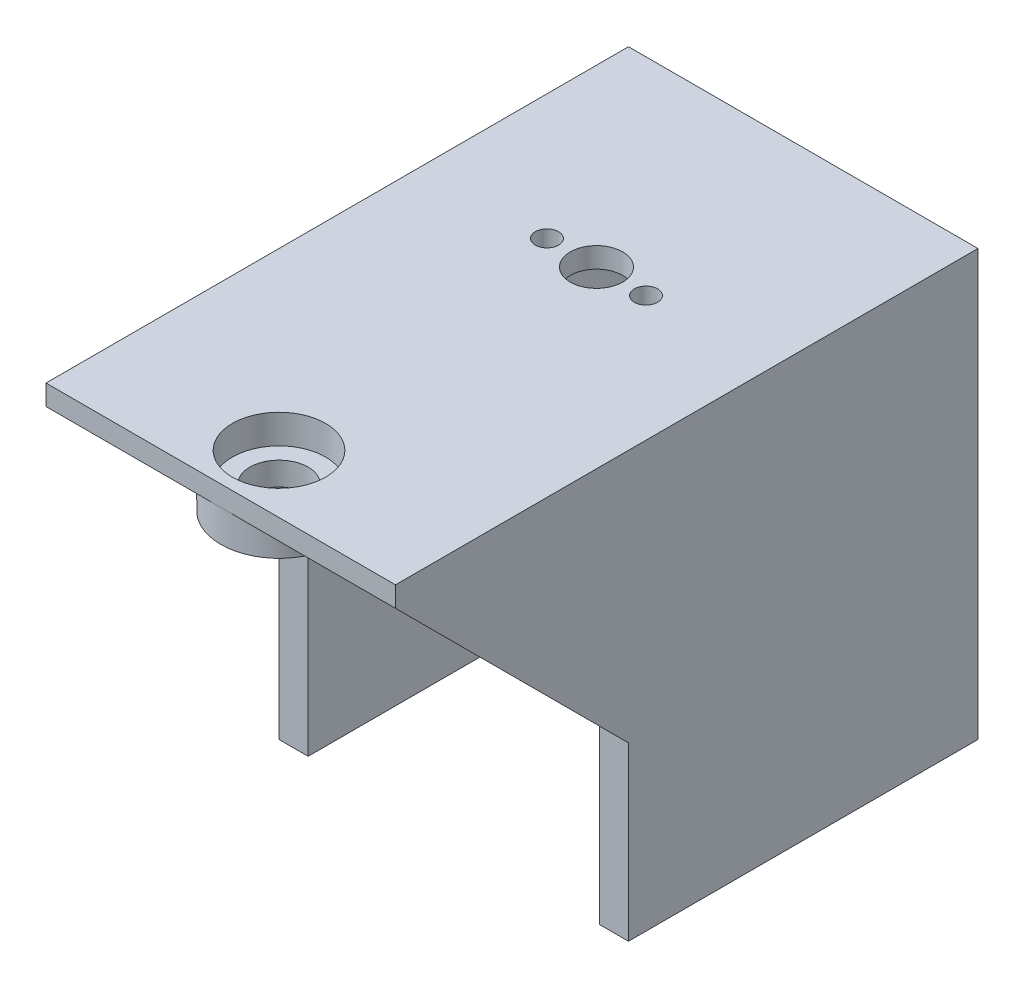
from build123d import *

# Parameters (mm, degrees)
CROQUIS1_W                       = 60
CROQUIS1_H                       = 60
SALIENTE_EXTRUIR1_DEPTH          = 73
CORTAR_EXTRUIR1_REACH            = 101.141
CROQUIS2_W                       = 50
CROQUIS2_H                       = 69.5
CORTAR_EXTRUIR2_REACH            = 86.433
CROQUIS3_R                       = 2
CHAFL_N1_SIZE                    = 5
TALADRO_DE_MARGEN_PARA_M31_D     = 3.4
TALADRO_DE_MARGEN_PARA_M31_DEPTH = 40
TALADRO_DE_MARGEN_PARA_M31_TIP   = 1.021463052
TALADRO_DE_MARGEN_PARA_M32_D     = 3.4
TALADRO_DE_MARGEN_PARA_M32_DEPTH = 40
TALADRO_DE_MARGEN_PARA_M32_TIP   = 1.021463052
TALADRO_DE_MARGEN_PARA_M33_D     = 3.4
TALADRO_DE_MARGEN_PARA_M33_DEPTH = 40
TALADRO_DE_MARGEN_PARA_M33_TIP   = 1.021463052
CROQUIS11_W                      = 60
CROQUIS11_H                      = 3.5
SALIENTE_EXTRUIR2_DEPTH          = 40
CHAFL_N2_SIZE                    = 40
CORTAR_EXTRUIR3_REACH            = 107.494
CROQUIS12_R                      = 2.5
CROQUIS14_R                      = 10
SALIENTE_EXTRUIR3_DEPTH          = 7
CROQUIS15_R                      = 10
SALIENTE_EXTRUIR4_DEPTH          = 2
CROQUIS13_R                      = 8
CORTAR_EXTRUIR5_DEPTH            = 5
CROQUIS16_R                      = 5
CORTAR_EXTRUIR6_DEPTH            = 5
CROQUIS17_R                      = 4.5
CORTAR_EXTRUIR7_DEPTH            = 16


with BuildPart() as part:
    # Croquis1 → Saliente-Extruir1 (new body)
    with BuildSketch(Plane(origin=(0, 0, 0), x_dir=(1, 0, 0), z_dir=(0, 1, 0))):
        Rectangle(CROQUIS1_W, CROQUIS1_H)
    extrude(amount=SALIENTE_EXTRUIR1_DEPTH)

    # Croquis2 → Cortar-Extruir1 (cut, up to next)
    with BuildSketch(Plane.XY.offset(30), mode=Mode.PRIVATE) as cortar_extruir1_sk1:
        with Locations((0, 34.75)):
            Rectangle(CROQUIS2_W, CROQUIS2_H)
    cortar_extruir1_tool1 = extrude(cortar_extruir1_sk1.sketch, amount=-CORTAR_EXTRUIR1_REACH, mode=Mode.PRIVATE) & part.part
    add(cortar_extruir1_tool1.solids().sort_by_distance((0, 34.75, 30))[0], mode=Mode.SUBTRACT)

    # Croquis3 → Cortar-Extruir2 (cut, up to next)
    with BuildSketch(Plane(origin=(0, 73, 0), x_dir=(1, 0, 0), z_dir=(0, 1, 0)), mode=Mode.PRIVATE) as cortar_extruir2_sk1:
        with Locations(Location((-8.5, -5.5, 0), (0, 0, 270))):
            Circle(CROQUIS3_R)
    cortar_extruir2_tool1 = extrude(cortar_extruir2_sk1.sketch, amount=-CORTAR_EXTRUIR2_REACH, mode=Mode.PRIVATE) & part.part
    # Croquis3 → Cortar-Extruir2 (cut, up to next)
    with BuildSketch(Plane(origin=(0, 73, 0), x_dir=(1, 0, 0), z_dir=(0, 1, 0)), mode=Mode.PRIVATE) as cortar_extruir2_sk2:
        with Locations(Location((8.5, -5.5, 0), (0, 0, 270))):
            Circle(CROQUIS3_R)
    cortar_extruir2_tool2 = extrude(cortar_extruir2_sk2.sketch, amount=-CORTAR_EXTRUIR2_REACH, mode=Mode.PRIVATE) & part.part
    add(cortar_extruir2_tool1.solids().sort_by_distance((-8.5, 73, 5.5))[0], mode=Mode.SUBTRACT)
    add(cortar_extruir2_tool2.solids().sort_by_distance((8.5, 73, 5.5))[0], mode=Mode.SUBTRACT)

    # Chaflán1
    chafl_n1_edges = [part.edges().sort_by_distance(p)[0] for p in [
        (-25, 69.5, 0),
        (25, 69.5, 0),
    ]]
    chamfer(chafl_n1_edges, length=CHAFL_N1_SIZE)

    # Taladro de margen para M31
    with Locations(Plane.XZ):
        with Locations((27.5, -20), (27.5, 20)):
            Hole(TALADRO_DE_MARGEN_PARA_M31_D / 2, depth=TALADRO_DE_MARGEN_PARA_M31_DEPTH)
            with Locations((0, 0, -(TALADRO_DE_MARGEN_PARA_M31_DEPTH + TALADRO_DE_MARGEN_PARA_M31_TIP / 2))):  # 118° drill point
                Cone(0, TALADRO_DE_MARGEN_PARA_M31_D / 2, TALADRO_DE_MARGEN_PARA_M31_TIP, mode=Mode.SUBTRACT)

    # Taladro de margen para M32
    with Locations(Plane.XZ):
        with Locations((-27.5, 20), (-27.5, -20)):
            Hole(TALADRO_DE_MARGEN_PARA_M32_D / 2, depth=TALADRO_DE_MARGEN_PARA_M32_DEPTH)
            with Locations((0, 0, -(TALADRO_DE_MARGEN_PARA_M32_DEPTH + TALADRO_DE_MARGEN_PARA_M32_TIP / 2))):  # 118° drill point
                Cone(0, TALADRO_DE_MARGEN_PARA_M32_D / 2, TALADRO_DE_MARGEN_PARA_M32_TIP, mode=Mode.SUBTRACT)

    # Taladro de margen para M33
    with Locations(Plane.XZ):
        with Locations((-27.5, 0), (27.5, 1.783505525)):
            Hole(TALADRO_DE_MARGEN_PARA_M33_D / 2, depth=TALADRO_DE_MARGEN_PARA_M33_DEPTH)
            with Locations((0, 0, -(TALADRO_DE_MARGEN_PARA_M33_DEPTH + TALADRO_DE_MARGEN_PARA_M33_TIP / 2))):  # 118° drill point
                Cone(0, TALADRO_DE_MARGEN_PARA_M33_D / 2, TALADRO_DE_MARGEN_PARA_M33_TIP, mode=Mode.SUBTRACT)

    # Croquis11 → Saliente-Extruir2 (add)
    with BuildSketch(Plane.XY.offset(30)):
        with Locations((0, 71.25)):
            Rectangle(CROQUIS11_W, CROQUIS11_H)
    extrude(amount=SALIENTE_EXTRUIR2_DEPTH)

    # Chaflán2
    # the kernel refuses this chamfer: 40 mm, written as the material it adds along each edge
    with BuildSketch(Plane(origin=(30, 69.5, 30), x_dir=(0, -0.9996219169112968, -0.027495876610586403), z_dir=(-1, 0, 0))) as chafl_n2_piece_1_section:
        Polygon((CHAFL_N2_SIZE * 0.999621916911, CHAFL_N2_SIZE * 0.0274958766106), (-CHAFL_N2_SIZE * 0.0274958766106, CHAFL_N2_SIZE * 0.999621916911), (0, 0), align=None)
    chafl_n2_piece_1 = extrude(amount=112.867319519, mode=Mode.PRIVATE)
    chafl_n2_piece_1 = split(chafl_n2_piece_1, bisect_by=Plane(origin=(25, 65.769230769, 48.134615385), z_dir=(1, 0, 0)), keep=Keep.TOP, mode=Mode.PRIVATE)
    add(chafl_n2_piece_1)
    with BuildSketch(Plane(origin=(132.867319519, 69.5, 30), x_dir=(0, -0.9996219169112968, -0.027495876610586403), z_dir=(-1, 0, 0))) as chafl_n2_piece_2_section:
        Polygon((CHAFL_N2_SIZE * 0.999621916911, CHAFL_N2_SIZE * 0.0274958766106), (-CHAFL_N2_SIZE * 0.0274958766106, CHAFL_N2_SIZE * 0.999621916911), (0, 0), align=None)
    chafl_n2_piece_2 = extrude(amount=215.734639037, mode=Mode.PRIVATE)
    chafl_n2_piece_2 = split(chafl_n2_piece_2, bisect_by=Plane(origin=(22.472826087, 67.027173913, 49.184782609), z_dir=(0.7071067811865476, 0.7071067811865476, 0)), keep=Keep.TOP, mode=Mode.PRIVATE)
    chafl_n2_piece_2 = split(chafl_n2_piece_2, bisect_by=Plane(origin=(25, 67.869565217, 49.184782609), z_dir=(-1, 0, 0)), keep=Keep.TOP, mode=Mode.PRIVATE)
    add(chafl_n2_piece_2)
    with BuildSketch(Plane(origin=(132.867319519, 69.5, 30), x_dir=(0, -0.9996219169112968, -0.027495876610586403), z_dir=(-1, 0, 0))) as chafl_n2_piece_3_section:
        Polygon((CHAFL_N2_SIZE * 0.999621916911, CHAFL_N2_SIZE * 0.0274958766106), (-CHAFL_N2_SIZE * 0.0274958766106, CHAFL_N2_SIZE * 0.999621916911), (0, 0), align=None)
    chafl_n2_piece_3 = extrude(amount=215.734639037, mode=Mode.PRIVATE)
    chafl_n2_piece_3 = split(chafl_n2_piece_3, bisect_by=Plane(origin=(-30, 67.869565217, 49.184782609), z_dir=(1, 0, 0)), keep=Keep.TOP, mode=Mode.PRIVATE)
    chafl_n2_piece_3 = split(chafl_n2_piece_3, bisect_by=Plane(origin=(-22.472826087, 67.027173913, 49.184782609), z_dir=(-0.7071067811865476, 0.7071067811865476, 0)), keep=Keep.TOP, mode=Mode.PRIVATE)
    add(chafl_n2_piece_3)
    with BuildSketch(Plane(origin=(132.867319519, 69.5, 30), x_dir=(0, -0.9996219169112968, -0.027495876610586403), z_dir=(-1, 0, 0))) as chafl_n2_piece_4_section:
        Polygon((CHAFL_N2_SIZE * 0.999621916911, CHAFL_N2_SIZE * 0.0274958766106), (-CHAFL_N2_SIZE * 0.0274958766106, CHAFL_N2_SIZE * 0.999621916911), (0, 0), align=None)
    chafl_n2_piece_4 = extrude(amount=215.734639037, mode=Mode.PRIVATE)
    chafl_n2_piece_4 = split(chafl_n2_piece_4, bisect_by=Plane(origin=(-25, 51.251968504, 40.875984252), z_dir=(-1, 0, 0)), keep=Keep.TOP, mode=Mode.PRIVATE)
    chafl_n2_piece_4 = split(chafl_n2_piece_4, bisect_by=Plane(origin=(-30, 51.251968504, 40.875984252), z_dir=(1, 0, 0)), keep=Keep.TOP, mode=Mode.PRIVATE)
    add(chafl_n2_piece_4)
    with BuildSketch(Plane(origin=(82.867319519, 69.5, 30), x_dir=(0, -0.9996219169112968, -0.027495876610586403), z_dir=(-1, 0, 0))) as chafl_n2_piece_5_section:
        Polygon((CHAFL_N2_SIZE * 0.999621916911, CHAFL_N2_SIZE * 0.0274958766106), (-CHAFL_N2_SIZE * 0.0274958766106, CHAFL_N2_SIZE * 0.999621916911), (0, 0), align=None)
    chafl_n2_piece_5 = extrude(amount=215.734639037, mode=Mode.PRIVATE)
    chafl_n2_piece_5 = split(chafl_n2_piece_5, bisect_by=Plane(origin=(30, 65.769230769, 48.134615385), z_dir=(-1, 0, 0)), keep=Keep.TOP, mode=Mode.PRIVATE)
    chafl_n2_piece_5 = split(chafl_n2_piece_5, bisect_by=Plane(origin=(25, 65.769230769, 48.134615385), z_dir=(1, 0, 0)), keep=Keep.TOP, mode=Mode.PRIVATE)
    add(chafl_n2_piece_5)
    with BuildSketch(Plane(origin=(82.867319519, 69.5, 30), x_dir=(0, -0.9996219169112968, -0.027495876610586403), z_dir=(-1, 0, 0))) as chafl_n2_piece_6_section:
        Polygon((CHAFL_N2_SIZE * 0.999621916911, CHAFL_N2_SIZE * 0.0274958766106), (-CHAFL_N2_SIZE * 0.0274958766106, CHAFL_N2_SIZE * 0.999621916911), (0, 0), align=None)
    chafl_n2_piece_6 = extrude(amount=215.734639037, mode=Mode.PRIVATE)
    chafl_n2_piece_6 = split(chafl_n2_piece_6, bisect_by=Plane(origin=(22.472826087, 67.027173913, 49.184782609), z_dir=(0.7071067811865476, 0.7071067811865476, 0)), keep=Keep.TOP, mode=Mode.PRIVATE)
    chafl_n2_piece_6 = split(chafl_n2_piece_6, bisect_by=Plane(origin=(25, 67.869565217, 49.184782609), z_dir=(-1, 0, 0)), keep=Keep.TOP, mode=Mode.PRIVATE)
    add(chafl_n2_piece_6)
    with BuildSketch(Plane(origin=(82.867319519, 69.5, 30), x_dir=(0, -0.9996219169112968, -0.027495876610586403), z_dir=(-1, 0, 0))) as chafl_n2_piece_7_section:
        Polygon((CHAFL_N2_SIZE * 0.999621916911, CHAFL_N2_SIZE * 0.0274958766106), (-CHAFL_N2_SIZE * 0.0274958766106, CHAFL_N2_SIZE * 0.999621916911), (0, 0), align=None)
    chafl_n2_piece_7 = extrude(amount=112.867319519, mode=Mode.PRIVATE)
    chafl_n2_piece_7 = split(chafl_n2_piece_7, bisect_by=Plane(origin=(-22.472826087, 67.027173913, 49.184782609), z_dir=(-0.7071067811865476, 0.7071067811865476, 0)), keep=Keep.TOP, mode=Mode.PRIVATE)
    add(chafl_n2_piece_7)
    with BuildSketch(Plane(origin=(82.867319519, 69.5, 30), x_dir=(0, -0.9996219169112968, -0.027495876610586403), z_dir=(-1, 0, 0))) as chafl_n2_piece_8_section:
        Polygon((CHAFL_N2_SIZE * 0.999621916911, CHAFL_N2_SIZE * 0.0274958766106), (-CHAFL_N2_SIZE * 0.0274958766106, CHAFL_N2_SIZE * 0.999621916911), (0, 0), align=None)
    chafl_n2_piece_8 = extrude(amount=112.867319519, mode=Mode.PRIVATE)
    chafl_n2_piece_8 = split(chafl_n2_piece_8, bisect_by=Plane(origin=(-25, 51.251968504, 40.875984252), z_dir=(-1, 0, 0)), keep=Keep.TOP, mode=Mode.PRIVATE)
    add(chafl_n2_piece_8)

    # Croquis12 → Cortar-Extruir3 (cut, up to next)
    with BuildSketch(Plane(origin=(0, 73, 0), x_dir=(1, 0, 0), z_dir=(0, 1, 0)), mode=Mode.PRIVATE) as cortar_extruir3_sk1:
        with Locations(Location((0, -60, 0), (0, 0, 270))):
            Circle(CROQUIS12_R)
    cortar_extruir3_tool1 = extrude(cortar_extruir3_sk1.sketch, amount=-CORTAR_EXTRUIR3_REACH, mode=Mode.PRIVATE) & part.part
    add(cortar_extruir3_tool1.solids().sort_by_distance((0, 73, 60))[0], mode=Mode.SUBTRACT)

    # Croquis14 → Saliente-Extruir3 (add)
    with BuildSketch(Plane(origin=(0, 73, 0), x_dir=(1, 0, 0), z_dir=(0, 1, 0))):
        with Locations(Location((0, -60, 0), (0, 0, 270))):
            Circle(CROQUIS14_R)
    extrude(amount=-SALIENTE_EXTRUIR3_DEPTH)

    # Croquis15 → Saliente-Extruir4 (add)
    with BuildSketch(Plane.XZ.offset(-66)):
        with Locations(Location((0, 60, 0), (0, 0, 90))):
            Circle(CROQUIS15_R)
    extrude(amount=SALIENTE_EXTRUIR4_DEPTH)

    # Croquis13 → Cortar-Extruir5 (cut)
    with BuildSketch(Plane(origin=(0, 73, 0), x_dir=(1, 0, 0), z_dir=(0, 1, 0))):
        with Locations(Location((0, -60, 0), (0, 0, 270))):
            Circle(CROQUIS13_R)
    extrude(amount=-CORTAR_EXTRUIR5_DEPTH, mode=Mode.SUBTRACT)

    # Croquis16 → Cortar-Extruir6 (cut)
    with BuildSketch(Plane(origin=(0, 68, 0), x_dir=(1, 0, 0), z_dir=(0, 1, 0))):
        with Locations(Location((0, -60, 0), (0, 0, 270))):
            Circle(CROQUIS16_R)
    extrude(amount=-CORTAR_EXTRUIR6_DEPTH, mode=Mode.SUBTRACT)

    # Croquis17 → Cortar-Extruir7 (cut)
    with BuildSketch(Plane(origin=(0, 73, 0), x_dir=(1, 0, 0), z_dir=(0, 1, 0))):
        with Locations(Location((0, -5.5, 0), (0, 0, 270))):
            Circle(CROQUIS17_R)
    extrude(amount=-CORTAR_EXTRUIR7_DEPTH, mode=Mode.SUBTRACT)


solid = part.part
